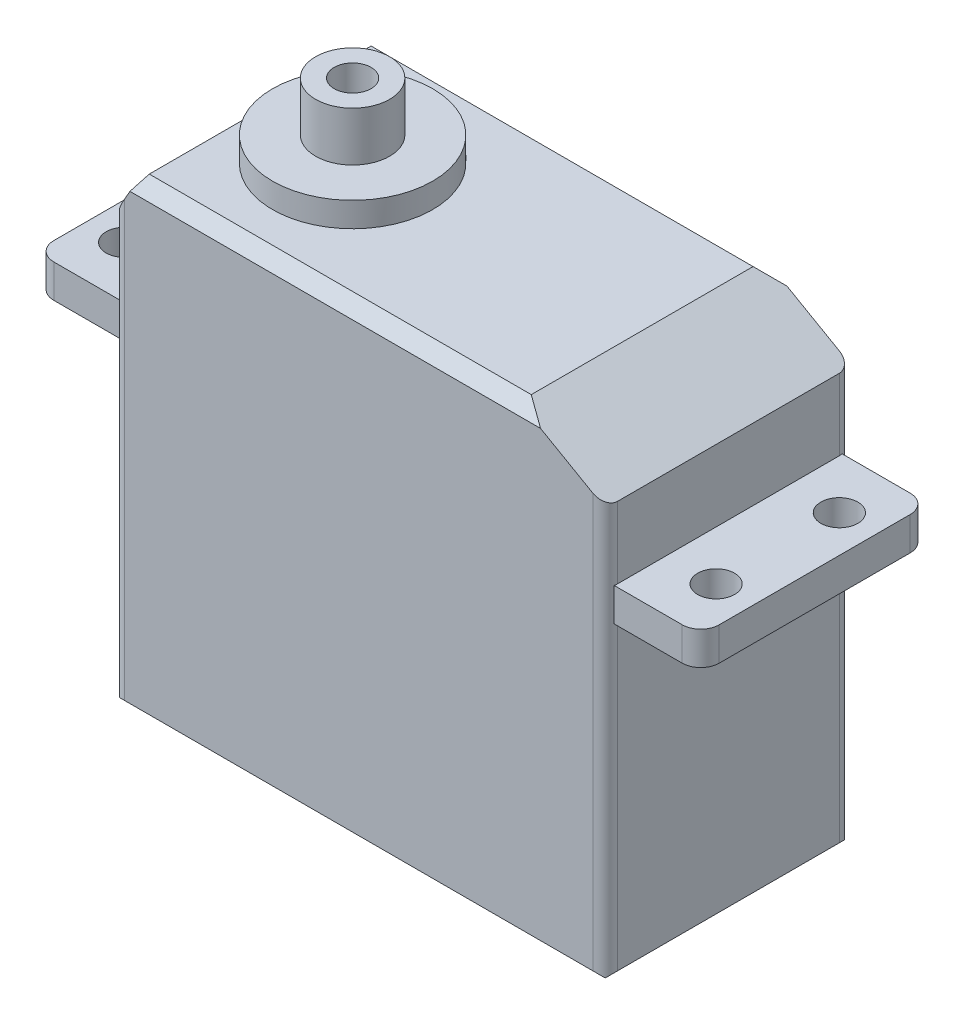
from build123d import *

# Parameters (mm, degrees)
SKETCH_1_W          = 40
SKETCH_1_H          = 39
EXTRUDE_1_DEPTH     = 20
SKETCH_2_W          = 18.5
SKETCH_2_H          = 2.7
EXTRUDE_2_DEPTH     = 7
SKETCH_3_W          = 18.5
SKETCH_3_H          = 2.7
EXTRUDE_3_DEPTH     = 7
SKETCH_4_R          = 1.5
CUT_EXTRUDE_1_DEPTH = 7
CHAMFER_1_SIZE      = 2
CHAMFER_2_SIZE      = 2
CHAMFER_2_SIZE2     = 3.5
CHAMFER_3_SIZE      = 4
CHAMFER_3_SIZE2     = 7
CHAMFER_4_SIZE      = 1
SKETCH_5_R          = 6.5
EXTRUDE_4_DEPTH     = 2
SKETCH_6_R          = 3
SKETCH_6_R_2        = 1.5
EXTRUDE_5_DEPTH     = 4
FILLET_1_R          = 1.5
FILLET_2_R          = 1


with BuildPart() as part:
    # 草图1 → 凸台-拉伸1 (new body)
    with BuildSketch(Plane.XY):
        with Locations((20, 19.5)):
            Rectangle(SKETCH_1_W, SKETCH_1_H)
    extrude(amount=EXTRUDE_1_DEPTH)

    # 草图2 → 凸台-拉伸2 (add)
    with BuildSketch(Plane.ZY):
        with Locations((10, 27.85)):
            Rectangle(SKETCH_2_W, SKETCH_2_H)
    extrude(amount=EXTRUDE_2_DEPTH)

    # 草图3 → 凸台-拉伸3 (add)
    with BuildSketch(Plane(origin=(40, 0, 0), x_dir=(0, 0, -1), z_dir=(1, 0, 0))):
        with Locations((-10, 27.85)):
            Rectangle(SKETCH_3_W, SKETCH_3_H)
    extrude(amount=EXTRUDE_3_DEPTH)

    # 草图4 → 切除-拉伸1 (cut)
    with BuildSketch(Plane(origin=(0, 29.2, 0), x_dir=(1, 0, 0), z_dir=(0, 1, 0))):
        with Locations(Location((-4, -5, 0), (0, 0, 270))):
            Circle(SKETCH_4_R)
        with Locations(Location((44, -5, 0), (0, 0, 270))):
            Circle(SKETCH_4_R)
        with Locations(Location((-4, -15, 0), (0, 0, 270))):
            Circle(SKETCH_4_R)
        with Locations(Location((44, -15, 0), (0, 0, 270))):
            Circle(SKETCH_4_R)
    extrude(amount=-CUT_EXTRUDE_1_DEPTH, mode=Mode.SUBTRACT)

    # 倒角1
    chamfer_1_edges = [part.edges().sort_by_distance(p)[0] for p in [
        (20, 0, 0),
        (40, 0, 10),
        (0, 0, 10),
        (20, 0, 20),
    ]]
    chamfer(chamfer_1_edges, length=CHAMFER_1_SIZE)

    # 倒角2
    chamfer_2_edges = [part.edges().sort_by_distance(p)[0] for p in [
        (0, 39, 10),
    ]]
    chamfer_2_side = [part.faces().sort_by_distance(p)[0] for p in [
        (20, 39, 10),
    ]]
    chamfer(chamfer_2_edges, length=CHAMFER_2_SIZE, length2=CHAMFER_2_SIZE2, reference=chamfer_2_side[0])

    # 倒角3
    chamfer_3_edges = [part.edges().sort_by_distance(p)[0] for p in [
        (40, 39, 10),
    ]]
    chamfer_3_side = [part.faces().sort_by_distance(p)[0] for p in [
        (40, 19.967962466, 10),
    ]]
    chamfer(chamfer_3_edges, length=CHAMFER_3_SIZE, length2=CHAMFER_3_SIZE2, reference=chamfer_3_side[0])

    # 倒角4
    chamfer_4_edges = [part.edges().sort_by_distance(p)[0] for p in [
        (17.5, 39, 0),
        (17.5, 39, 20),
    ]]
    chamfer(chamfer_4_edges, length=CHAMFER_4_SIZE)

    # 草图5 → 凸台-拉伸4 (add)
    with BuildSketch(Plane(origin=(0, 39, 0), x_dir=(1, 0, 0), z_dir=(0, 1, 0))):
        with Locations(Location((9.5, -10, 0), (0, 0, 90))):
            Circle(SKETCH_5_R)
    extrude(amount=EXTRUDE_4_DEPTH)

    # 草图6 → 凸台-拉伸5 (add)
    with BuildSketch(Plane(origin=(0, 41, 0), x_dir=(1, 0, 0), z_dir=(0, 1, 0))):
        with Locations(Location((9.5, -10, 0), (0, 0, 270))):
            Circle(SKETCH_6_R)
        with Locations(Location((9.5, -10, 0), (0, 0, 270))):
            Circle(SKETCH_6_R_2, mode=Mode.SUBTRACT)
    extrude(amount=EXTRUDE_5_DEPTH)

    # 圆角1
    fillet_1_edges = [part.edges().sort_by_distance(p)[0] for p in [
        (-7, 27.85, 0.75),
        (-7, 27.85, 19.25),
        (47, 27.85, 19.25),
        (47, 27.85, 0.75),
    ]]
    fillet(fillet_1_edges, radius=FILLET_1_R)

    # 圆角2
    # the kernel refuses this fillet: 1 mm, written as the material it takes off along each edge
    with BuildSketch(Plane(origin=(0, 38, 20), x_dir=(1, 0, 0), z_dir=(0, -1, 0))) as fillet_2_piece_1_section:
        with BuildLine():
            CenterArc((FILLET_2_R, -FILLET_2_R), FILLET_2_R, 90, 90)
            Line((0, -FILLET_2_R), (0, 0))
            Line((0, 0), (FILLET_2_R, 0))
        make_face()
    fillet_2_piece_1 = extrude(amount=38.5, mode=Mode.PRIVATE)
    fillet_2_piece_1 = split(fillet_2_piece_1, bisect_by=Plane(origin=(0.233478453, 29.2, 19.792941909), z_dir=(0, 1, 0)), keep=Keep.TOP, mode=Mode.PRIVATE)
    fillet_2_piece_1 = split(fillet_2_piece_1, bisect_by=Plane(origin=(0.233478453, 33.6, 19.25), z_dir=(0, 0, 1)), keep=Keep.TOP, mode=Mode.PRIVATE)
    add(fillet_2_piece_1, mode=Mode.SUBTRACT)
    with BuildSketch(Plane(origin=(0, 38, 20), x_dir=(1, 0, 0), z_dir=(0, -1, 0))) as fillet_2_piece_2_section:
        with BuildLine():
            CenterArc((FILLET_2_R, -FILLET_2_R), FILLET_2_R, 90, 90)
            Line((0, -FILLET_2_R), (0, 0))
            Line((0, 0), (FILLET_2_R, 0))
        make_face()
    fillet_2_piece_2 = extrude(amount=38.5, mode=Mode.PRIVATE)
    fillet_2_piece_2 = split(fillet_2_piece_2, bisect_by=Plane(origin=(-0.003280029, 29.2, 19.146607635), z_dir=(0, 1, 0)), keep=Keep.TOP, mode=Mode.PRIVATE)
    fillet_2_piece_2 = split(fillet_2_piece_2, bisect_by=Plane(origin=(-0.003280029, 33.6, 19.25), z_dir=(0, 0, -1)), keep=Keep.TOP, mode=Mode.PRIVATE)
    add(fillet_2_piece_2, mode=Mode.SUBTRACT)
    with BuildSketch(Plane(origin=(0, 38, 20), x_dir=(1, 0, 0), z_dir=(0, -1, 0))) as fillet_2_piece_3_section:
        with BuildLine():
            CenterArc((FILLET_2_R, -FILLET_2_R), FILLET_2_R, 90, 90)
            Line((0, -FILLET_2_R), (0, 0))
            Line((0, 0), (FILLET_2_R, 0))
        make_face()
    fillet_2_piece_3 = extrude(amount=38.5, mode=Mode.PRIVATE)
    fillet_2_piece_3 = split(fillet_2_piece_3, bisect_by=Plane(origin=(0.233478453, 29.2, 19.792941909), z_dir=(0, -1, 0)), keep=Keep.TOP, mode=Mode.PRIVATE)
    fillet_2_piece_3 = split(fillet_2_piece_3, bisect_by=Plane(origin=(0.233478453, 27.85, 19.25), z_dir=(0, 0, 1)), keep=Keep.TOP, mode=Mode.PRIVATE)
    fillet_2_piece_3 = split(fillet_2_piece_3, bisect_by=Plane(origin=(0.233478453, 26.5, 19.792941909), z_dir=(0, 1, 0)), keep=Keep.TOP, mode=Mode.PRIVATE)
    add(fillet_2_piece_3, mode=Mode.SUBTRACT)
    with BuildSketch(Plane(origin=(0, 38, 20), x_dir=(1, 0, 0), z_dir=(0, -1, 0))) as fillet_2_piece_4_section:
        with BuildLine():
            CenterArc((FILLET_2_R, -FILLET_2_R), FILLET_2_R, 90, 90)
            Line((0, -FILLET_2_R), (0, 0))
            Line((0, 0), (FILLET_2_R, 0))
        make_face()
    fillet_2_piece_4 = extrude(amount=38.5, mode=Mode.PRIVATE)
    fillet_2_piece_4 = split(fillet_2_piece_4, bisect_by=Plane(origin=(0.233478453, 13, 19.25), z_dir=(0, 0, 1)), keep=Keep.TOP, mode=Mode.PRIVATE)
    fillet_2_piece_4 = split(fillet_2_piece_4, bisect_by=Plane(origin=(0.233478453, 26.5, 19.792941909), z_dir=(0, -1, 0)), keep=Keep.TOP, mode=Mode.PRIVATE)
    add(fillet_2_piece_4, mode=Mode.SUBTRACT)
    with BuildSketch(Plane(origin=(0, 38, 20), x_dir=(1, 0, 0), z_dir=(0, -1, 0))) as fillet_2_piece_5_section:
        with BuildLine():
            CenterArc((FILLET_2_R, -FILLET_2_R), FILLET_2_R, 90, 90)
            Line((0, -FILLET_2_R), (0, 0))
            Line((0, 0), (FILLET_2_R, 0))
        make_face()
    fillet_2_piece_5 = extrude(amount=38.5, mode=Mode.PRIVATE)
    fillet_2_piece_5 = split(fillet_2_piece_5, bisect_by=Plane(origin=(-0.003280029, 13, 19.25), z_dir=(0, 0, -1)), keep=Keep.TOP, mode=Mode.PRIVATE)
    fillet_2_piece_5 = split(fillet_2_piece_5, bisect_by=Plane(origin=(-0.003280029, 26.5, 19.146607635), z_dir=(0, -1, 0)), keep=Keep.TOP, mode=Mode.PRIVATE)
    add(fillet_2_piece_5, mode=Mode.SUBTRACT)
    with BuildSketch(Plane(origin=(0, 38, 0), x_dir=(1, 0, 0), z_dir=(0, -1, 0))) as fillet_2_piece_6_section:
        with BuildLine():
            CenterArc((FILLET_2_R, FILLET_2_R), FILLET_2_R, 180, 90)
            Line((0, FILLET_2_R), (0, 0))
            Line((0, 0), (FILLET_2_R, 0))
        make_face()
    fillet_2_piece_6 = extrude(amount=38.5, mode=Mode.PRIVATE)
    fillet_2_piece_6 = split(fillet_2_piece_6, bisect_by=Plane(origin=(0.233478453, 29.2, 0.207058091), z_dir=(0, 1, 0)), keep=Keep.TOP, mode=Mode.PRIVATE)
    fillet_2_piece_6 = split(fillet_2_piece_6, bisect_by=Plane(origin=(0.233478453, 33.6, 0.75), z_dir=(0, 0, -1)), keep=Keep.TOP, mode=Mode.PRIVATE)
    add(fillet_2_piece_6, mode=Mode.SUBTRACT)
    with BuildSketch(Plane(origin=(0, 38, 0), x_dir=(1, 0, 0), z_dir=(0, -1, 0))) as fillet_2_piece_7_section:
        with BuildLine():
            CenterArc((FILLET_2_R, FILLET_2_R), FILLET_2_R, 180, 90)
            Line((0, FILLET_2_R), (0, 0))
            Line((0, 0), (FILLET_2_R, 0))
        make_face()
    fillet_2_piece_7 = extrude(amount=38.5, mode=Mode.PRIVATE)
    fillet_2_piece_7 = split(fillet_2_piece_7, bisect_by=Plane(origin=(-0.003280029, 29.2, 0.853392365), z_dir=(0, 1, 0)), keep=Keep.TOP, mode=Mode.PRIVATE)
    fillet_2_piece_7 = split(fillet_2_piece_7, bisect_by=Plane(origin=(-0.003280029, 33.6, 0.75), z_dir=(0, 0, 1)), keep=Keep.TOP, mode=Mode.PRIVATE)
    add(fillet_2_piece_7, mode=Mode.SUBTRACT)
    with BuildSketch(Plane(origin=(0, 38, 0), x_dir=(1, 0, 0), z_dir=(0, -1, 0))) as fillet_2_piece_8_section:
        with BuildLine():
            CenterArc((FILLET_2_R, FILLET_2_R), FILLET_2_R, 180, 90)
            Line((0, FILLET_2_R), (0, 0))
            Line((0, 0), (FILLET_2_R, 0))
        make_face()
    fillet_2_piece_8 = extrude(amount=38.5, mode=Mode.PRIVATE)
    fillet_2_piece_8 = split(fillet_2_piece_8, bisect_by=Plane(origin=(0.233478453, 29.2, 0.207058091), z_dir=(0, -1, 0)), keep=Keep.TOP, mode=Mode.PRIVATE)
    fillet_2_piece_8 = split(fillet_2_piece_8, bisect_by=Plane(origin=(0.233478453, 26.5, 0.207058091), z_dir=(0, 1, 0)), keep=Keep.TOP, mode=Mode.PRIVATE)
    fillet_2_piece_8 = split(fillet_2_piece_8, bisect_by=Plane(origin=(0.233478453, 27.85, 0.75), z_dir=(0, 0, -1)), keep=Keep.TOP, mode=Mode.PRIVATE)
    add(fillet_2_piece_8, mode=Mode.SUBTRACT)
    with BuildSketch(Plane(origin=(0, 38, 0), x_dir=(1, 0, 0), z_dir=(0, -1, 0))) as fillet_2_piece_9_section:
        with BuildLine():
            CenterArc((FILLET_2_R, FILLET_2_R), FILLET_2_R, 180, 90)
            Line((0, FILLET_2_R), (0, 0))
            Line((0, 0), (FILLET_2_R, 0))
        make_face()
    fillet_2_piece_9 = extrude(amount=38.5, mode=Mode.PRIVATE)
    fillet_2_piece_9 = split(fillet_2_piece_9, bisect_by=Plane(origin=(0.233478453, 26.5, 0.207058091), z_dir=(0, -1, 0)), keep=Keep.TOP, mode=Mode.PRIVATE)
    fillet_2_piece_9 = split(fillet_2_piece_9, bisect_by=Plane(origin=(0.233478453, 13, 0.75), z_dir=(0, 0, -1)), keep=Keep.TOP, mode=Mode.PRIVATE)
    add(fillet_2_piece_9, mode=Mode.SUBTRACT)
    with BuildSketch(Plane(origin=(0, 38, 0), x_dir=(1, 0, 0), z_dir=(0, -1, 0))) as fillet_2_piece_10_section:
        with BuildLine():
            CenterArc((FILLET_2_R, FILLET_2_R), FILLET_2_R, 180, 90)
            Line((0, FILLET_2_R), (0, 0))
            Line((0, 0), (FILLET_2_R, 0))
        make_face()
    fillet_2_piece_10 = extrude(amount=38.5, mode=Mode.PRIVATE)
    fillet_2_piece_10 = split(fillet_2_piece_10, bisect_by=Plane(origin=(-0.003280029, 26.5, 0.853392365), z_dir=(0, -1, 0)), keep=Keep.TOP, mode=Mode.PRIVATE)
    fillet_2_piece_10 = split(fillet_2_piece_10, bisect_by=Plane(origin=(-0.003280029, 13, 0.75), z_dir=(0, 0, 1)), keep=Keep.TOP, mode=Mode.PRIVATE)
    add(fillet_2_piece_10, mode=Mode.SUBTRACT)
    with BuildSketch(Plane(origin=(40, -0.5, 0), x_dir=(0, 0, 1), z_dir=(0, 1, 0))) as fillet_2_piece_11_section:
        with BuildLine():
            CenterArc((FILLET_2_R, -FILLET_2_R), FILLET_2_R, 90, 90)
            Line((0, -FILLET_2_R), (0, 0))
            Line((0, 0), (FILLET_2_R, 0))
        make_face()
    fillet_2_piece_11 = extrude(amount=38, mode=Mode.PRIVATE)
    fillet_2_piece_11 = split(fillet_2_piece_11, bisect_by=Plane(origin=(40.003280029, 26.5, 0.853392365), z_dir=(0, -1, 0)), keep=Keep.TOP, mode=Mode.PRIVATE)
    fillet_2_piece_11 = split(fillet_2_piece_11, bisect_by=Plane(origin=(40.003280029, 13, 0.75), z_dir=(0, 0, 1)), keep=Keep.TOP, mode=Mode.PRIVATE)
    add(fillet_2_piece_11, mode=Mode.SUBTRACT)
    with BuildSketch(Plane(origin=(40, -0.5, 0), x_dir=(0, 0, 1), z_dir=(0, 1, 0))) as fillet_2_piece_12_section:
        with BuildLine():
            CenterArc((FILLET_2_R, -FILLET_2_R), FILLET_2_R, 90, 90)
            Line((0, -FILLET_2_R), (0, 0))
            Line((0, 0), (FILLET_2_R, 0))
        make_face()
    fillet_2_piece_12 = extrude(amount=38, mode=Mode.PRIVATE)
    fillet_2_piece_12 = split(fillet_2_piece_12, bisect_by=Plane(origin=(39.766521547, 26.5, 0.207058091), z_dir=(0, -1, 0)), keep=Keep.TOP, mode=Mode.PRIVATE)
    fillet_2_piece_12 = split(fillet_2_piece_12, bisect_by=Plane(origin=(39.766521547, 13, 0.75), z_dir=(0, 0, -1)), keep=Keep.TOP, mode=Mode.PRIVATE)
    add(fillet_2_piece_12, mode=Mode.SUBTRACT)
    with BuildSketch(Plane(origin=(40, -0.5, 0), x_dir=(0, 0, 1), z_dir=(0, 1, 0))) as fillet_2_piece_13_section:
        with BuildLine():
            CenterArc((FILLET_2_R, -FILLET_2_R), FILLET_2_R, 90, 90)
            Line((0, -FILLET_2_R), (0, 0))
            Line((0, 0), (FILLET_2_R, 0))
        make_face()
    fillet_2_piece_13 = extrude(amount=38, mode=Mode.PRIVATE)
    fillet_2_piece_13 = split(fillet_2_piece_13, bisect_by=Plane(origin=(39.766521547, 26.5, 0.207058091), z_dir=(0, 1, 0)), keep=Keep.TOP, mode=Mode.PRIVATE)
    fillet_2_piece_13 = split(fillet_2_piece_13, bisect_by=Plane(origin=(39.766521547, 29.2, 0.207058091), z_dir=(0, -1, 0)), keep=Keep.TOP, mode=Mode.PRIVATE)
    fillet_2_piece_13 = split(fillet_2_piece_13, bisect_by=Plane(origin=(39.766521547, 27.85, 0.75), z_dir=(0, 0, -1)), keep=Keep.TOP, mode=Mode.PRIVATE)
    add(fillet_2_piece_13, mode=Mode.SUBTRACT)
    with BuildSketch(Plane(origin=(40, -0.5, 0), x_dir=(0, 0, 1), z_dir=(0, 1, 0))) as fillet_2_piece_14_section:
        with BuildLine():
            CenterArc((FILLET_2_R, -FILLET_2_R), FILLET_2_R, 90, 90)
            Line((0, -FILLET_2_R), (0, 0))
            Line((0, 0), (FILLET_2_R, 0))
        make_face()
    fillet_2_piece_14 = extrude(amount=38, mode=Mode.PRIVATE)
    fillet_2_piece_14 = split(fillet_2_piece_14, bisect_by=Plane(origin=(40.003280029, 29.2, 0.853392365), z_dir=(0, 1, 0)), keep=Keep.TOP, mode=Mode.PRIVATE)
    fillet_2_piece_14 = split(fillet_2_piece_14, bisect_by=Plane(origin=(40.003280029, 33.35, 0.75), z_dir=(0, 0, 1)), keep=Keep.TOP, mode=Mode.PRIVATE)
    add(fillet_2_piece_14, mode=Mode.SUBTRACT)
    with BuildSketch(Plane(origin=(40, -0.5, 0), x_dir=(0, 0, 1), z_dir=(0, 1, 0))) as fillet_2_piece_15_section:
        with BuildLine():
            CenterArc((FILLET_2_R, -FILLET_2_R), FILLET_2_R, 90, 90)
            Line((0, -FILLET_2_R), (0, 0))
            Line((0, 0), (FILLET_2_R, 0))
        make_face()
    fillet_2_piece_15 = extrude(amount=38, mode=Mode.PRIVATE)
    fillet_2_piece_15 = split(fillet_2_piece_15, bisect_by=Plane(origin=(39.766521547, 29.2, 0.207058091), z_dir=(0, 1, 0)), keep=Keep.TOP, mode=Mode.PRIVATE)
    fillet_2_piece_15 = split(fillet_2_piece_15, bisect_by=Plane(origin=(39.766521547, 33.35, 0.75), z_dir=(0, 0, -1)), keep=Keep.TOP, mode=Mode.PRIVATE)
    add(fillet_2_piece_15, mode=Mode.SUBTRACT)
    with BuildSketch(Plane(origin=(40, -0.5, 20), x_dir=(0, 0, -1), z_dir=(0, 1, 0))) as fillet_2_piece_16_section:
        with BuildLine():
            CenterArc((FILLET_2_R, FILLET_2_R), FILLET_2_R, 180, 90)
            Line((0, FILLET_2_R), (0, 0))
            Line((0, 0), (FILLET_2_R, 0))
        make_face()
    fillet_2_piece_16 = extrude(amount=38, mode=Mode.PRIVATE)
    fillet_2_piece_16 = split(fillet_2_piece_16, bisect_by=Plane(origin=(40.003280029, 26.5, 19.146607635), z_dir=(0, -1, 0)), keep=Keep.TOP, mode=Mode.PRIVATE)
    fillet_2_piece_16 = split(fillet_2_piece_16, bisect_by=Plane(origin=(40.003280029, 13, 19.25), z_dir=(0, 0, -1)), keep=Keep.TOP, mode=Mode.PRIVATE)
    add(fillet_2_piece_16, mode=Mode.SUBTRACT)
    with BuildSketch(Plane(origin=(40, -0.5, 20), x_dir=(0, 0, -1), z_dir=(0, 1, 0))) as fillet_2_piece_17_section:
        with BuildLine():
            CenterArc((FILLET_2_R, FILLET_2_R), FILLET_2_R, 180, 90)
            Line((0, FILLET_2_R), (0, 0))
            Line((0, 0), (FILLET_2_R, 0))
        make_face()
    fillet_2_piece_17 = extrude(amount=38, mode=Mode.PRIVATE)
    fillet_2_piece_17 = split(fillet_2_piece_17, bisect_by=Plane(origin=(39.766521547, 26.5, 19.792941909), z_dir=(0, -1, 0)), keep=Keep.TOP, mode=Mode.PRIVATE)
    fillet_2_piece_17 = split(fillet_2_piece_17, bisect_by=Plane(origin=(39.766521547, 13, 19.25), z_dir=(0, 0, 1)), keep=Keep.TOP, mode=Mode.PRIVATE)
    add(fillet_2_piece_17, mode=Mode.SUBTRACT)
    with BuildSketch(Plane(origin=(40, -0.5, 20), x_dir=(0, 0, -1), z_dir=(0, 1, 0))) as fillet_2_piece_18_section:
        with BuildLine():
            CenterArc((FILLET_2_R, FILLET_2_R), FILLET_2_R, 180, 90)
            Line((0, FILLET_2_R), (0, 0))
            Line((0, 0), (FILLET_2_R, 0))
        make_face()
    fillet_2_piece_18 = extrude(amount=38, mode=Mode.PRIVATE)
    fillet_2_piece_18 = split(fillet_2_piece_18, bisect_by=Plane(origin=(39.766521547, 26.5, 19.792941909), z_dir=(0, 1, 0)), keep=Keep.TOP, mode=Mode.PRIVATE)
    fillet_2_piece_18 = split(fillet_2_piece_18, bisect_by=Plane(origin=(39.766521547, 27.85, 19.25), z_dir=(0, 0, 1)), keep=Keep.TOP, mode=Mode.PRIVATE)
    fillet_2_piece_18 = split(fillet_2_piece_18, bisect_by=Plane(origin=(39.766521547, 29.2, 19.792941909), z_dir=(0, -1, 0)), keep=Keep.TOP, mode=Mode.PRIVATE)
    add(fillet_2_piece_18, mode=Mode.SUBTRACT)
    with BuildSketch(Plane(origin=(40, -0.5, 20), x_dir=(0, 0, -1), z_dir=(0, 1, 0))) as fillet_2_piece_19_section:
        with BuildLine():
            CenterArc((FILLET_2_R, FILLET_2_R), FILLET_2_R, 180, 90)
            Line((0, FILLET_2_R), (0, 0))
            Line((0, 0), (FILLET_2_R, 0))
        make_face()
    fillet_2_piece_19 = extrude(amount=38, mode=Mode.PRIVATE)
    fillet_2_piece_19 = split(fillet_2_piece_19, bisect_by=Plane(origin=(40.003280029, 33.35, 19.25), z_dir=(0, 0, -1)), keep=Keep.TOP, mode=Mode.PRIVATE)
    fillet_2_piece_19 = split(fillet_2_piece_19, bisect_by=Plane(origin=(40.003280029, 29.2, 19.146607635), z_dir=(0, 1, 0)), keep=Keep.TOP, mode=Mode.PRIVATE)
    add(fillet_2_piece_19, mode=Mode.SUBTRACT)
    with BuildSketch(Plane(origin=(40, -0.5, 20), x_dir=(0, 0, -1), z_dir=(0, 1, 0))) as fillet_2_piece_20_section:
        with BuildLine():
            CenterArc((FILLET_2_R, FILLET_2_R), FILLET_2_R, 180, 90)
            Line((0, FILLET_2_R), (0, 0))
            Line((0, 0), (FILLET_2_R, 0))
        make_face()
    fillet_2_piece_20 = extrude(amount=38, mode=Mode.PRIVATE)
    fillet_2_piece_20 = split(fillet_2_piece_20, bisect_by=Plane(origin=(39.766521547, 33.35, 19.25), z_dir=(0, 0, 1)), keep=Keep.TOP, mode=Mode.PRIVATE)
    fillet_2_piece_20 = split(fillet_2_piece_20, bisect_by=Plane(origin=(39.766521547, 29.2, 19.792941909), z_dir=(0, 1, 0)), keep=Keep.TOP, mode=Mode.PRIVATE)
    add(fillet_2_piece_20, mode=Mode.SUBTRACT)


solid = part.part
